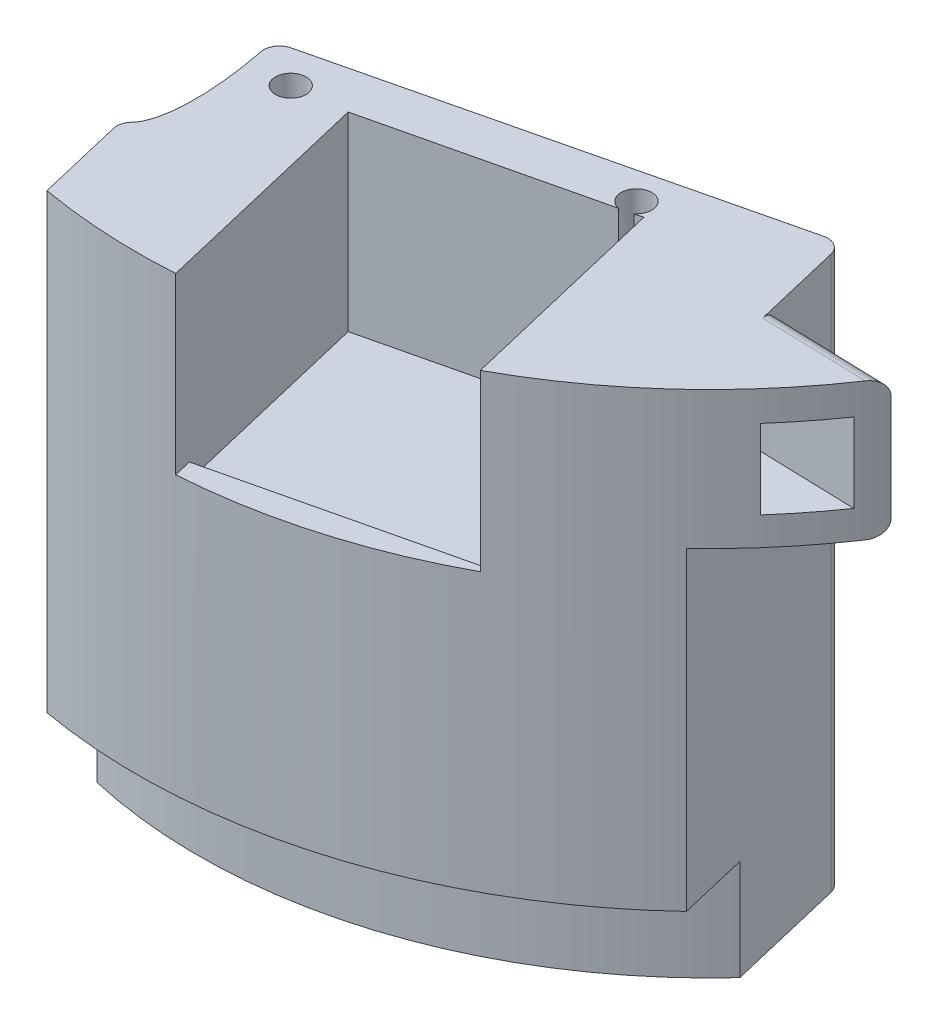
from build123d import *

# Parameters (mm, degrees)
BOSS_EXTRUDE1_DEPTH          = 88.5939681
CUT_EXTRUDE5_DEPTH           = 30.48
SKETCH13_W                   = 39.37
SKETCH13_H                   = 27.94
CUT_EXTRUDE6_DEPTH           = 121.173808566
SKETCH17_W                   = 9.779
SKETCH17_H                   = 16.129
SKETCH20_W                   = 22.076995977
SKETCH20_H                   = 19.05
BOSS_EXTRUDE2_DEPTH          = 43.18
CUT_EXTRUDE9_START           = -22.076995977
CUT_EXTRUDE9_DEPTH           = 22.076995977
FILLET2_R                    = 2.54
CUT_EXTRUDE11_DEPTH          = 150.440180481
F_10_0_1935_DIAMETER_HOLE1_D = 4.9149
CUT_EXTRUDE14_DEPTH          = 12.7
FILLET5_R                    = 2.54
SKETCH31_RX                  = 22.225
SKETCH31_RY                  = 6.35
CUT_EXTRUDE16_DEPTH          = 150.440180481
FILLET6_R                    = 2.54
SKETCH32_R                   = 9.525
CUT_EXTRUDE17_DEPTH          = 6.35


# Read off the part's stored shape, not the designer's step: Cut-Extrude9
with BuildPart() as part:
    # Sketch1 → Boss-Extrude1 (new body)
    with BuildSketch(Plane(origin=(0, 0, 0), x_dir=(1, 0, 0), z_dir=(0, 1, 0))):
        with BuildLine():
            Line((63.017839503, -66.782093), (53.468205472, -26.506342671))
            Line((53.468205472, -26.506342671), (-35.875703335, -47.690346072))
            Line((-35.875703335, -47.690346072), (-26.326069304, -87.966096401))
            ThreePointArc((-26.326069304, -87.966096401), (21.184003401, -89.343908807), (63.017839503, -66.782093))
        make_face()
    extrude(amount=BOSS_EXTRUDE1_DEPTH)

    # Sketch12 → Cut-Extrude5 (cut)
    with BuildSketch(Plane(origin=(0, 88.5939681, 0), x_dir=(1, 0, 0), z_dir=(0, 1, 0))):
        Polygon((5.316172436, -88.753304237), (43.624072478, -79.670259902), (35.713033863, -46.305314704), (-2.594866179, -55.388359039), align=None)
    extrude(amount=-CUT_EXTRUDE5_DEPTH, mode=Mode.SUBTRACT)

    # Sketch13 → Cut-Extrude6 (cut, through all)
    with BuildSketch(Plane(origin=(20.206823904, 0, 85.222637004), x_dir=(-0.9730226071044289, 0, 0.23070978753338656), z_dir=(-0.23070978753338653, 0, -0.9730226071044288))):
        with Locations((-4.3815, 74.6239681)):
            Rectangle(SKETCH13_W, SKETCH13_H)
    extrude(amount=-CUT_EXTRUDE6_DEPTH, mode=Mode.SUBTRACT)

    # Sketch17 → Cut-Revolve1 (revolve, cut)
    with BuildSketch(Plane(origin=(0, 0, 0), x_dir=(0.2779727925443418, 0, 0.9605889477841708), z_dir=(-0.9605889477841708, 0, 0.2779727925443418))):
        with Locations((86.934262311, 8.0645)):
            Rectangle(SKETCH17_W, SKETCH17_H)
    revolve(axis=Axis((0, 88.5939681, 0), (0, -1, 0)), mode=Mode.SUBTRACT)

    # Sketch20 → Boss-Extrude2 (add)
    with BuildSketch(Plane(origin=(46.161246838, 0, 1.33869588), x_dir=(0, -1, 0), z_dir=(0.9995797526704859, 0, 0.02898823987775881))):
        with Locations((-77.555470112, -56.021383933)):
            Rectangle(SKETCH20_W, SKETCH20_H)
    extrude(amount=BOSS_EXTRUDE2_DEPTH)

    # Cut-Extrude9 outline → Cut-Extrude9 (cut)
    with BuildSketch(Plane(origin=(0, 88.5939681, 0), x_dir=(1, 0, 0), z_dir=(0, 1, 0)).offset(CUT_EXTRUDE9_START)):
        with BuildLine():
            Line((87.975252227, -49.06725203), (77.797045472, -48.772079686))
            ThreePointArc((77.797045472, -48.772079686), (70.701096399, -58.587123236), (62.37506144, -67.382844638))
            Line((62.37506144, -67.382844638), (87.423026258, -68.109246318))
            Line((87.423026258, -68.109246318), (87.975252227, -49.06725203))
        make_face()
    extrude(amount=CUT_EXTRUDE9_DEPTH, mode=Mode.SUBTRACT)

    # Fillet2
    fillet2_edges = [part.edges().sort_by_distance(p)[0] for p in [
        (68.206351325, 66.516972123, 48.493945458),
        (68.206351325, 88.5939681, 48.493945458),
        (-35.875703335, 44.29698405, 47.690346072),
        (53.468205472, 44.29698405, 26.506342671),
    ]]
    fillet(fillet2_edges, radius=FILLET2_R)

    # Sketch25 → Cut-Extrude11 (cut, through all)
    with BuildSketch(Plane.XZ):
        Polygon((-24.667480264, 53.125115211), (-13.767913037, 99.094232658), (-26.000188569, 101.994582217), (-40.190153369, 42.148154842), (65.286931214, 17.138873869), (68.442798797, 30.762859127), align=None)
    extrude(amount=-CUT_EXTRUDE11_DEPTH, mode=Mode.SUBTRACT)

    # #10 (0.1935) Diameter Hole1 (through all)
    with Locations(Plane(origin=(0, 0, 0), x_dir=(-1, 0, 0), z_dir=(0, -1, 0))):
        with Locations((10.85357172, -56.338005803), (-32.898719503, -44.680648661)):
            Hole(F_10_0_1935_DIAMETER_HOLE1_D / 2)

    # Sketch30 → Cut-Extrude14 (cut)
    with BuildSketch(Plane(origin=(0, 71.0679681, 0), x_dir=(1, 0, 0), z_dir=(0, 1, 0))):
        Polygon((30.706346029, -52.713276699), (36.885039584, -51.248269548), (81.505966291, -52.542295486), (81.257041939, -61.125767384), (38.936049595, -59.898440526), (32.75735604, -61.363447676), align=None)
    extrude(amount=CUT_EXTRUDE14_DEPTH, mode=Mode.SUBTRACT)

    # Fillet5
    fillet5_edges = [part.edges().sort_by_distance(p)[0] for p in [
        (55.229871942, 44.29698405, 33.936202145),
    ]]
    fillet(fillet5_edges, radius=FILLET5_R)

    # Sketch31 → Cut-Extrude16 (cut, through all)
    with BuildSketch(Plane.XZ):
        with Locations(Location((-24.667480264, 53.125115211), (0, 0, 76.661136503))):
            Ellipse(SKETCH31_RX, SKETCH31_RY)
    extrude(amount=-CUT_EXTRUDE16_DEPTH, mode=Mode.SUBTRACT)

    # Fillet6
    fillet6_edges = [part.edges().sort_by_distance(p)[0] for p in [
        (-18.49303476, 44.29698405, 51.642201263),
        (-19.539955236, 44.29698405, 74.750542654),
    ]]
    fillet(fillet6_edges, radius=FILLET6_R)

    # Sketch32 → Cut-Extrude17 (cut)
    with BuildSketch(Plane.XZ):
        with Locations(Location((12.111377962, 63.170347591, 0), (0, 0, 270))):
            Circle(SKETCH32_R)
    extrude(amount=-CUT_EXTRUDE17_DEPTH, mode=Mode.SUBTRACT)


solid = part.part
